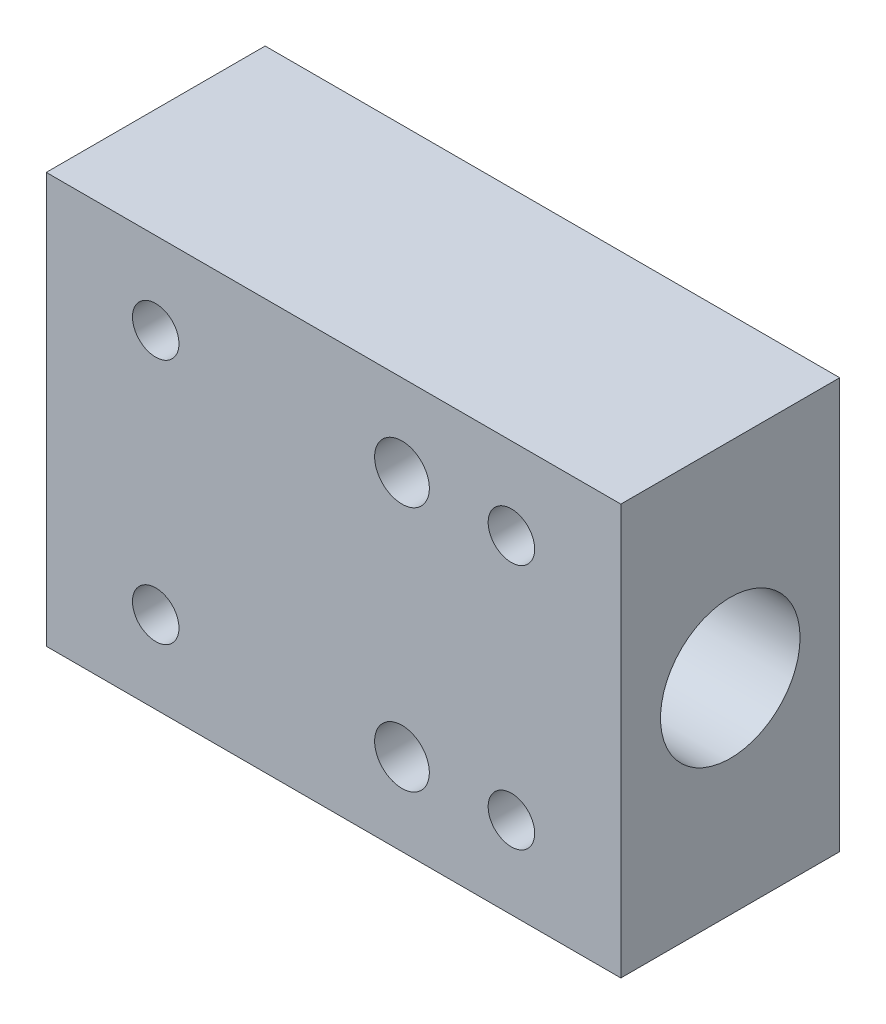
from build123d import *

# Parameters (mm, degrees)
CROQUIS1_W                                           = 42
CROQUIS1_H                                           = 30
SALIENTE_EXTRUIR1_DEPTH                              = 16
CROQUIS2_R                                           = 5.1
CORTAR_EXTRUIR1_DEPTH                                = 55.037024344
REFRENTADO_PARA_TORNILLO_CON_CABEZA_HUEC_D           = 3.4
REFRENTADO_PARA_TORNILLO_CON_CABEZA_HUEC_CBORE_D     = 6.5
REFRENTADO_PARA_TORNILLO_CON_CABEZA_HUEC_CBORE_DEPTH = 3.4
DI_METRO_DE_TALADRO_4_0_4_1_D                        = 4


with BuildPart() as part:
    # Croquis1 → Saliente-Extruir1 (new body)
    with BuildSketch(Plane.XY):
        with Locations((21, 15)):
            Rectangle(CROQUIS1_W, CROQUIS1_H)
    extrude(amount=SALIENTE_EXTRUIR1_DEPTH)

    # Croquis2 → Cortar-Extruir1 (cut, through all)
    with BuildSketch(Plane(origin=(42, 0, 0), x_dir=(0, 0, -1), z_dir=(1, 0, 0))):
        with Locations((-8, 15)):
            Circle(CROQUIS2_R)
    extrude(amount=-CORTAR_EXTRUIR1_DEPTH, mode=Mode.SUBTRACT)

    # Refrentado para tornillo con cabeza hueca de M31 (through all)
    with Locations(Plane(origin=(0, 0, 0), x_dir=(-1, 0, 0), z_dir=(0, 0, -1))):
        with Locations((-8, 6), (-34, 6), (-34, 24), (-8, 24)):
            CounterBoreHole(REFRENTADO_PARA_TORNILLO_CON_CABEZA_HUEC_D / 2, REFRENTADO_PARA_TORNILLO_CON_CABEZA_HUEC_CBORE_D / 2, REFRENTADO_PARA_TORNILLO_CON_CABEZA_HUEC_CBORE_DEPTH)

    # Diámetro de taladro Ø4.0 (4)1 (through all)
    with Locations(Plane(origin=(0, 0, 0), x_dir=(-1, 0, 0), z_dir=(0, 0, -1))):
        with Locations((-26, 6), (-26, 24)):
            Hole(DI_METRO_DE_TALADRO_4_0_4_1_D / 2)


solid = part.part
